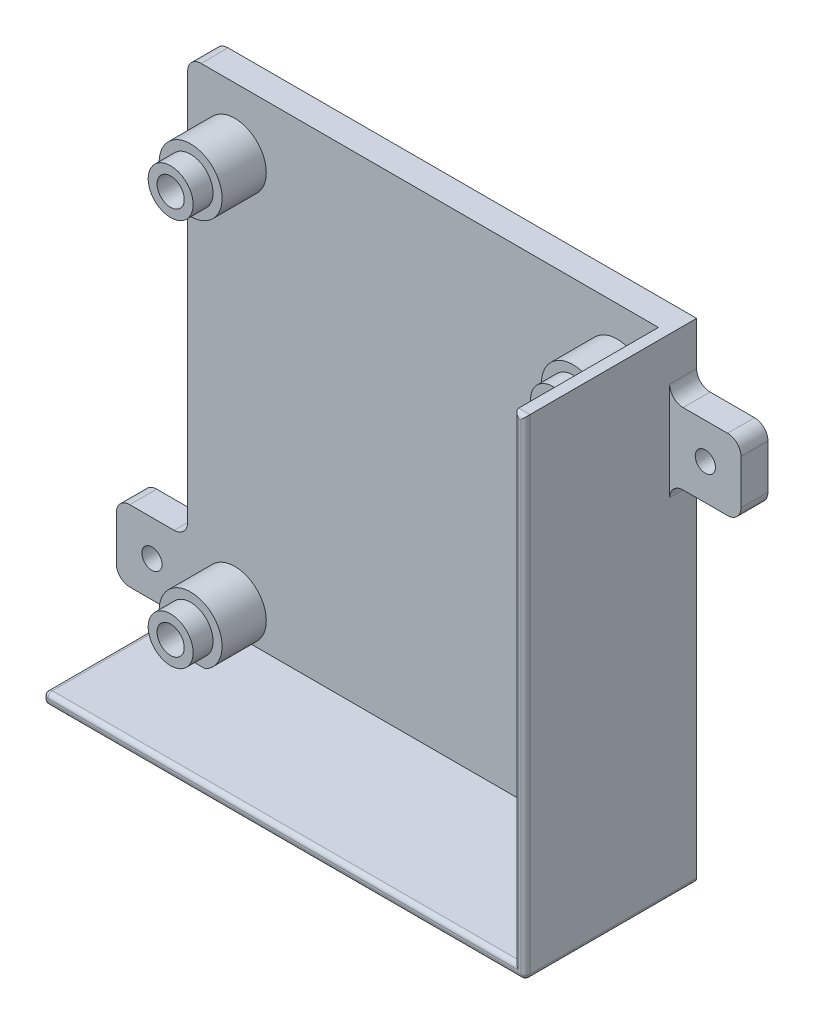
from build123d import *

# Parameters (mm, degrees)
SKETCH1_W            = 104.775
SKETCH1_H            = 106.3625
BOSS_EXTRUDE1_DEPTH  = 6
BOSS_EXTRUDE2_DEPTH  = 38.1
SKETCH3_R            = 5
SKETCH3_R_2          = 3.025
BOSS_EXTRUDE3_DEPTH  = 14.2875
SKETCH4_R            = 7
SKETCH4_R_2          = 3.025
BOSS_EXTRUDE4_DEPTH  = 9.8425
SKETCH6_W            = 15.875
SKETCH6_H            = 15.875
BOSS_EXTRUDE5_DEPTH  = 6
M4_CLEARANCE_HOLE1_D = 4.5
FILLET2_R            = 3
FILLET3_R            = 1


with BuildPart() as part:
    # Sketch1 → Boss-Extrude1 (new body)
    with BuildSketch(Plane.XY):
        Rectangle(SKETCH1_W, SKETCH1_H)
    extrude(amount=BOSS_EXTRUDE1_DEPTH)

    # Sketch2 → Boss-Extrude2 (add)
    with BuildSketch(Plane.XY):
        Polygon((-52.3875, -53.18125), (-52.3875, -55.68125), (54.8875, -55.68125), (54.8875, 53.18125), (52.3875, 53.18125), (52.3875, -53.18125), align=None)
    extrude(amount=BOSS_EXTRUDE2_DEPTH)

    # Sketch3 → Boss-Extrude3 (add)
    # profile 1 of 4: a face of its own
    with BuildSketch(Plane.XY.offset(6)):
        with Locations((43.208, 39.35095)):
            Circle(SKETCH3_R)
        with Locations((43.208, 39.35095)):
            Circle(SKETCH3_R_2, mode=Mode.SUBTRACT)
    # profile 2 of 4: a face of its own
    with BuildSketch(Plane.XY.offset(6)):
        with Locations((-41.882, 39.35095)):
            Circle(SKETCH3_R)
        with Locations((-41.882, 39.35095)):
            Circle(SKETCH3_R_2, mode=Mode.SUBTRACT)
    # profile 3 of 4: a face of its own
    with BuildSketch(Plane.XY.offset(6)):
        with Locations((-41.882, -47.00905)):
            Circle(SKETCH3_R)
        with Locations((-41.882, -47.00905)):
            Circle(SKETCH3_R_2, mode=Mode.SUBTRACT)
    # profile 4 of 4: a face of its own
    with BuildSketch(Plane.XY.offset(6)):
        with Locations((43.208, -47.00905)):
            Circle(SKETCH3_R)
        with Locations((43.208, -47.00905)):
            Circle(SKETCH3_R_2, mode=Mode.SUBTRACT)
    extrude(amount=BOSS_EXTRUDE3_DEPTH)

    # Sketch4 → Boss-Extrude4 (add)
    # profile 1 of 4: a face of its own
    with BuildSketch(Plane.XY.offset(6)):
        with Locations((43.208, 39.35095)):
            Circle(SKETCH4_R)
        with Locations((43.208, 39.35095)):
            Circle(SKETCH4_R_2, mode=Mode.SUBTRACT)
    # profile 2 of 4: a face of its own
    with BuildSketch(Plane.XY.offset(6)):
        with Locations((-41.882, 39.35095)):
            Circle(SKETCH4_R)
        with Locations((-41.882, 39.35095)):
            Circle(SKETCH4_R_2, mode=Mode.SUBTRACT)
    # profile 3 of 4: a face of its own
    with BuildSketch(Plane.XY.offset(6)):
        with Locations((-41.882, -47.00905)):
            Circle(SKETCH4_R)
        with Locations((-41.882, -47.00905)):
            Circle(SKETCH4_R_2, mode=Mode.SUBTRACT)
    # profile 4 of 4: a face of its own
    with BuildSketch(Plane.XY.offset(6)):
        with Locations((43.208, -47.00905)):
            Circle(SKETCH4_R)
        with Locations((43.208, -47.00905)):
            Circle(SKETCH4_R_2, mode=Mode.SUBTRACT)
    extrude(amount=BOSS_EXTRUDE4_DEPTH)

    # Sketch6 → Boss-Extrude5 (add)
    with BuildSketch(Plane.XY):
        with Locations((-60.325, -47.74375)):
            Rectangle(SKETCH6_W, SKETCH6_H)
        with Locations((62.825, 32.54375)):
            Rectangle(SKETCH6_W, SKETCH6_H)
    extrude(amount=BOSS_EXTRUDE5_DEPTH)

    # M4 Clearance Hole1 (through all)
    with Locations(Plane.XY.offset(6)):
        with Locations((62.825, 32.54375), (-60.325, -47.74375)):
            Hole(M4_CLEARANCE_HOLE1_D / 2)

    # Fillet2
    fillet2_edges = [part.edges().sort_by_distance(p)[0] for p in [
        (70.7625, 24.60625, 3),
        (70.7625, 40.48125, 3),
        (54.8875, 40.48125, 3),
        (54.8875, 24.60625, 3),
        (-68.2625, -55.68125, 3),
        (-68.2625, -39.80625, 3),
        (-52.3875, -39.80625, 3),
        (-52.3875, 53.18125, 3),
    ]]
    fillet(fillet2_edges, radius=FILLET2_R)

    # Fillet3
    fillet3_edges = [part.edges().sort_by_distance(p)[0] for p in [
        (52.3875, 0, 38.1),
        (53.6375, 53.18125, 38.1),
        (54.8875, -1.25, 38.1),
        (-52.3875, -54.43125, 38.1),
        (0, -53.18125, 38.1),
        (54.8875, -55.68125, 19.05),
        (1.25, -55.68125, 38.1),
        (-52.3875, -53.18125, 22.05),
        (-52.3875, -55.68125, 22.05),
    ]]
    fillet(fillet3_edges, radius=FILLET3_R)


solid = part.part
